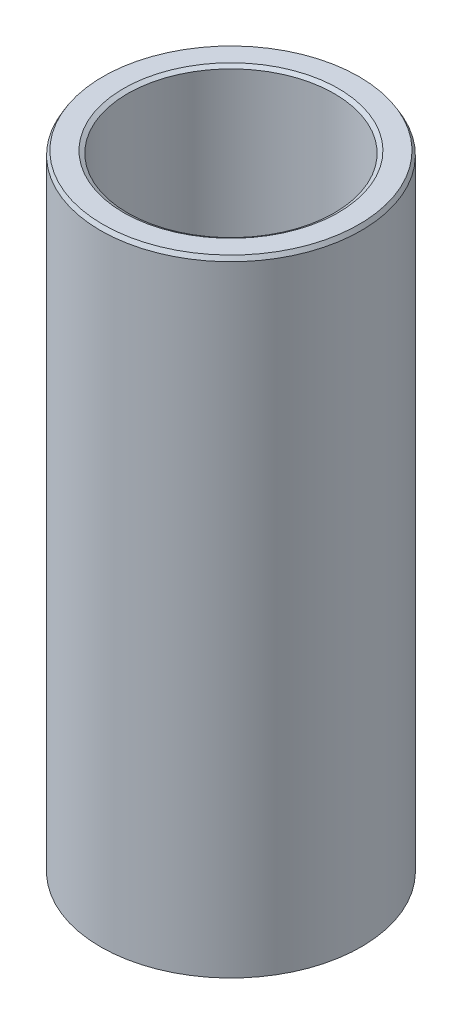
from build123d import *
from OCP.BRepFilletAPI import BRepFilletAPI_MakeChamfer

# Parameters (mm, degrees)
SKETCH1_R           = 40
BOSS_EXTRUDE1_DEPTH = 192.239043917
SKETCH2_R           = 31.706252534
CUT_EXTRUDE1_DEPTH  = 201.389246233
CHAMFER1_SIZE       = 1.25784914
CHAMFER1_SIZE2      = 0.72621954


with BuildPart() as part:
    # Sketch1 → Boss-Extrude1 (new body)
    with BuildSketch(Plane(origin=(0, 0, 0), x_dir=(1, 0, 0), z_dir=(0, 1, 0))):
        Circle(SKETCH1_R)
    extrude(amount=BOSS_EXTRUDE1_DEPTH)

    # Sketch2 → Cut-Extrude1 (cut, through all)
    with BuildSketch(Plane(origin=(0, 0, 0), x_dir=(1, 0, 0), z_dir=(0, 1, 0))):
        Circle(SKETCH2_R)
    extrude(amount=CUT_EXTRUDE1_DEPTH, mode=Mode.SUBTRACT)

    # Chamfer1: one chamfer whose edges measure the first distance from different faces: ONE call of the kernel's chamfer builder (chamfer() names one face for all edges)
    chamfer1_edges_1 = [part.edges().sort_by_distance(p)[0] for p in [
        (-31.706252534, 192.239043917, 0),
    ]]
    chamfer1_side_1 = [part.faces().sort_by_distance(p)[0] for p in [
        (-38.86862915, 192.239043917, 0),
    ]]
    chamfer1_edges_2 = [part.edges().sort_by_distance(p)[0] for p in [
        (-31.706252534, 0, 0),
    ]]
    chamfer1_side_2 = [part.faces().sort_by_distance(p)[0] for p in [
        (-31.706252534, 96.119521958, 0),
    ]]
    chamfer1_edges_3 = [part.edges().sort_by_distance(p)[0] for p in [
        (-40, 0, 0),
    ]]
    chamfer1_side_3 = [part.faces().sort_by_distance(p)[0] for p in [
        (-38.86862915, 0, 0),
    ]]
    chamfer1_edges_4 = [part.edges().sort_by_distance(p)[0] for p in [
        (-40, 192.239043917, 0),
    ]]
    chamfer1_side_4 = [part.faces().sort_by_distance(p)[0] for p in [
        (-40, 96.119521958, 0),
    ]]
    chamfer1 = BRepFilletAPI_MakeChamfer(part.part.solid().wrapped)
    for e in chamfer1_edges_1:
        chamfer1.Add(CHAMFER1_SIZE, CHAMFER1_SIZE2, e.wrapped, chamfer1_side_1[0].wrapped)  # the first distance lies on this face
    for e in chamfer1_edges_2:
        chamfer1.Add(CHAMFER1_SIZE, CHAMFER1_SIZE2, e.wrapped, chamfer1_side_2[0].wrapped)  # the first distance lies on this face
    for e in chamfer1_edges_3:
        chamfer1.Add(CHAMFER1_SIZE, CHAMFER1_SIZE2, e.wrapped, chamfer1_side_3[0].wrapped)  # the first distance lies on this face
    for e in chamfer1_edges_4:
        chamfer1.Add(CHAMFER1_SIZE, CHAMFER1_SIZE2, e.wrapped, chamfer1_side_4[0].wrapped)  # the first distance lies on this face
    add(Compound.cast(chamfer1.Shape()), mode=Mode.REPLACE)


solid = part.part
